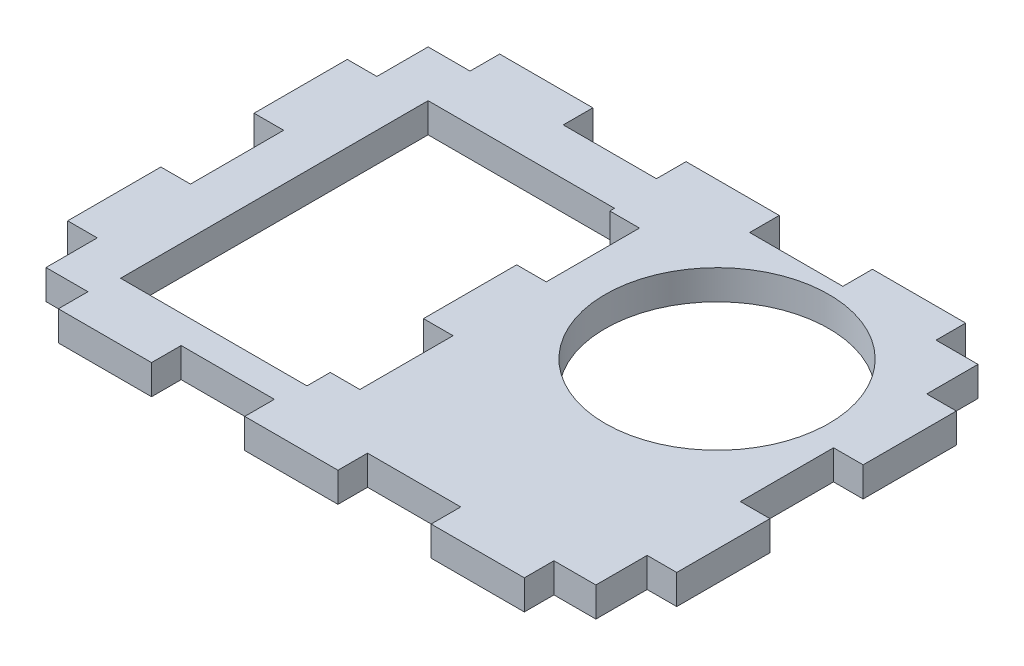
from build123d import *

# Parameters (mm, degrees)
SKETCH1_W           = 65.35
SKETCH1_H           = 47.35
SKETCH1_R           = 12
SKETCH1_W_2         = 20
SKETCH1_H_2         = 33
BOSS_EXTRUDE1_DEPTH = 3.175
SKETCH2_W           = 3.175
SKETCH2_H           = 10
SKETCH2_W_2         = 10
SKETCH2_H_2         = 3.175
CUT_EXTRUDE1_DEPTH  = 3.175


with BuildPart() as part:
    # Sketch1 → Boss-Extrude1 (new body)
    with BuildSketch(Plane(origin=(0, 0, 0), x_dir=(1, 0, 0), z_dir=(0, 1, 0))):
        with Locations((32.675, 23.675)):
            Rectangle(SKETCH1_W, SKETCH1_H)
        with Locations((47.675, 30.675)):
            Circle(SKETCH1_R, mode=Mode.SUBTRACT)
        with Locations((18.175, 22.675)):
            Rectangle(SKETCH1_W_2, SKETCH1_H_2, mode=Mode.SUBTRACT)
    extrude(amount=BOSS_EXTRUDE1_DEPTH)

    # Sketch2 → Cut-Extrude1 (cut)
    with BuildSketch(Plane(origin=(0, 3.175, 0), x_dir=(1, 0, 0), z_dir=(0, 1, 0))):
        Polygon((3.175, 3.175), (3.175, 8.675), (0, 8.675), (0, 0), (7.675, 0), (7.675, 3.175), align=None)
        with Locations((1.5875, 23.675)):
            Rectangle(SKETCH2_W, SKETCH2_H)
        Polygon((0, 38.675), (3.175, 38.675), (3.175, 44.175), (7.675, 44.175), (7.675, 47.35), (0, 47.35), align=None)
        with Locations((22.675, 1.5875)):
            Rectangle(SKETCH2_W_2, SKETCH2_H_2)
        with Locations((42.675, 1.5875)):
            Rectangle(SKETCH2_W_2, SKETCH2_H_2)
        Polygon((57.675, 3.175), (57.675, 0), (65.35, 0), (65.35, 8.675), (62.175, 8.675), (62.175, 3.175), align=None)
        with Locations((22.675, 45.7625)):
            Rectangle(SKETCH2_W_2, SKETCH2_H_2)
        with Locations((42.675, 45.7625)):
            Rectangle(SKETCH2_W_2, SKETCH2_H_2)
        with Locations((63.7625, 23.675)):
            Rectangle(SKETCH2_W, SKETCH2_H)
        Polygon((57.675, 47.35), (57.675, 44.175), (62.175, 44.175), (62.175, 38.675), (65.35, 38.675), (65.35, 47.35), align=None)
        with Locations((29.7625, 13.675)):
            Rectangle(SKETCH2_W, SKETCH2_H)
        with Locations((29.7625, 33.675)):
            Rectangle(SKETCH2_W, SKETCH2_H)
    extrude(amount=-CUT_EXTRUDE1_DEPTH, mode=Mode.SUBTRACT)


solid = part.part
